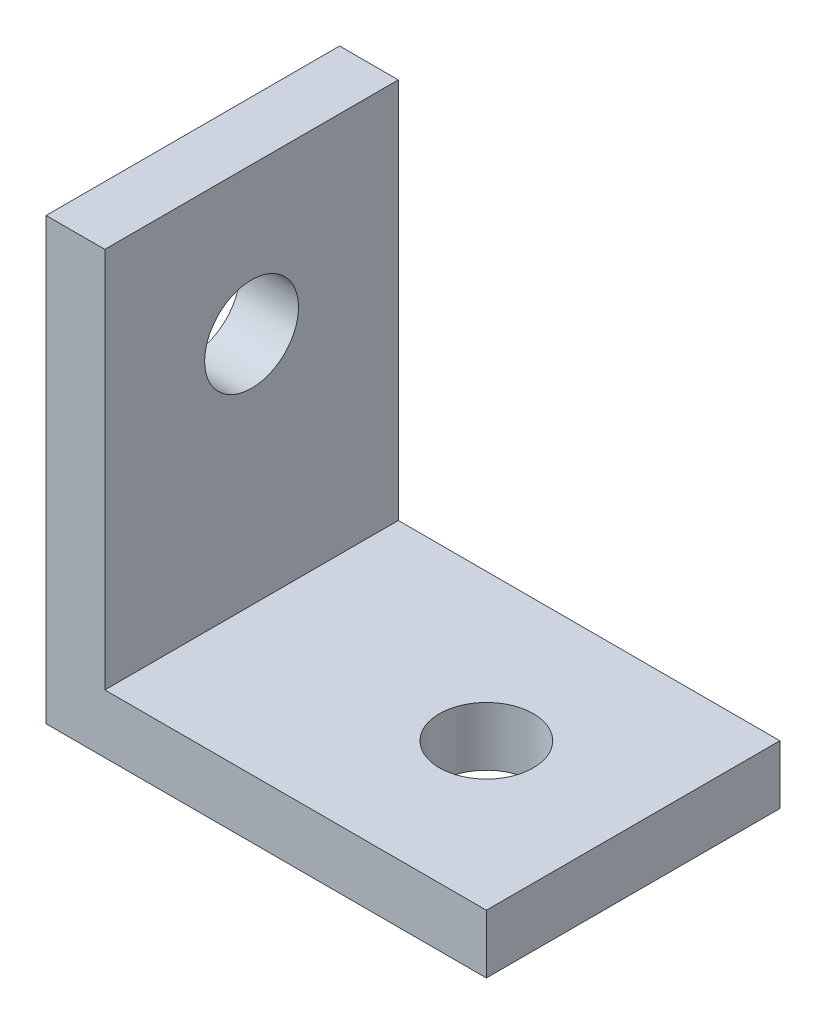
from build123d import *

# Parameters (mm, degrees)
BASE_DEPTH                       = 5
F_3_2_3_2_MOUNTHOLES_D           = 3.2
F_3_2_3_2_MOUNTHOLES_ON_FACE_2_D = 3.2


with BuildPart() as part:
    # Sketch1 → Base (new, symmetric)
    with BuildSketch(Plane.XY):
        Polygon((0, 0), (0, 15), (2, 15), (2, 2), (15, 2), (15, 0), align=None)
    extrude(amount=BASE_DEPTH, both=True)

    # Ø3.2 (3.2) MountHoles (through all)
    with Locations(Plane(origin=(0, 10, 0), x_dir=(0, 0, -1), z_dir=(-1, 0, 0))):
        with Locations((0, 0)):
            Hole(F_3_2_3_2_MOUNTHOLES_D / 2)

    # Ø3.2 (3.2) MountHoles on face 2 (through all)
    with Locations(Plane(origin=(10, 0, 0), x_dir=(0, 0, -1), z_dir=(0, -1, 0))):
        with Locations((0, 0)):
            Hole(F_3_2_3_2_MOUNTHOLES_ON_FACE_2_D / 2)


solid = part.part
